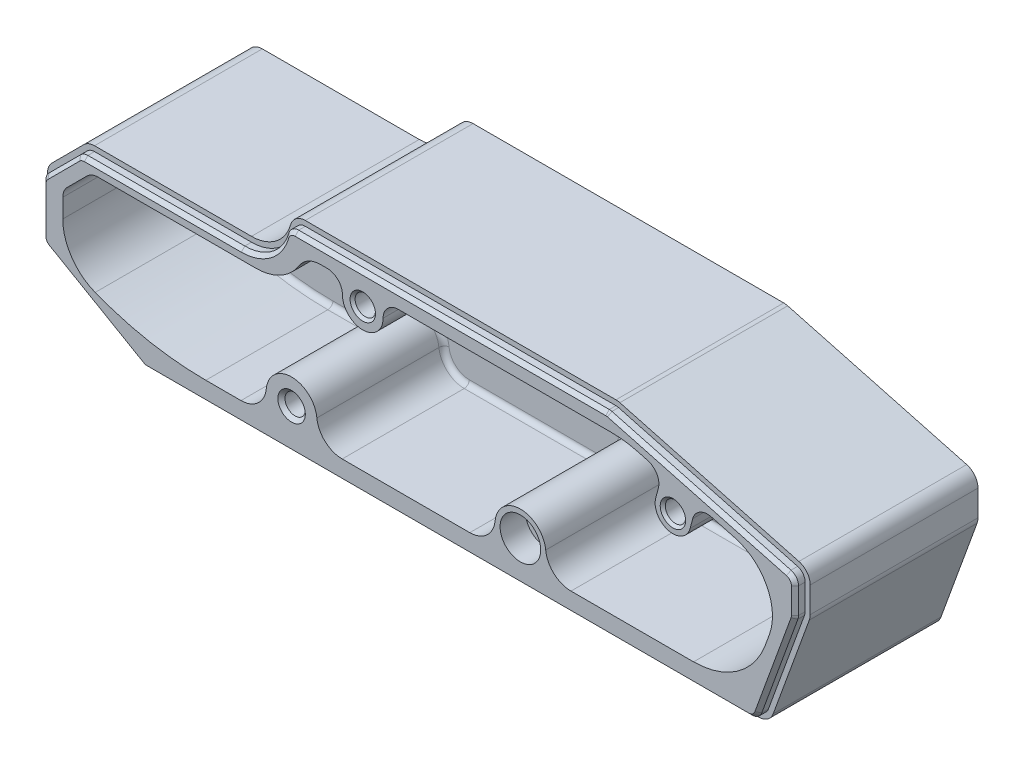
from build123d import *

# Parameters (mm, degrees)
EXTRUDE1_DEPTH     = 35
CUT_EXTRUDE1_DEPTH = 25
FILLET1_R          = 3
FILLET2_R          = 10
EXTRUDE2_DEPTH     = 25
FILLET3_R          = 5
FILLET4_R          = 3
CUT_SWEEP1_START   = 33
CUT_SWEEP1_DEPTH   = 2
CHAMFER1_SIZE      = 0.7
SKETCH6_R          = 2
CUT_EXTRUDE2_DEPTH = 15
CHAMFER2_SIZE      = 0.7
CHAMFER3_SIZE      = 0.5
FILLET5_R          = 1


# Read off the part's stored shape, not the designer's step: Cut-Sweep1
with BuildPart() as part:
    # Sketch1 → Extrude1 (new body)
    with BuildSketch(Plane.XY):
        with BuildLine():
            Line((-75, 4), (-67, 12))
            Line((-67, 12), (-34.892466166, 12))
            ThreePointArc((-34.892466166, 12), (-29.235611917, 14.343145751), (-26.892466166, 20))
            Line((-26.892466166, 20), (37.18825976, 20))
            Line((37.18825976, 20), (75, 9.868374738))
            Line((75, 9.868374738), (75, 1.979819356))
            Line((75, 1.979819356), (67, -20))
            Line((67, -20), (-54.215390309, -20))
            Line((-54.215390309, -20), (-75, -8))
            Line((-75, -8), (-75, 4))
        make_face()
    extrude(amount=EXTRUDE1_DEPTH)

    # Sketch2 → Cut-Extrude1 (cut)
    with BuildSketch(Plane.XY.offset(35)):
        with BuildLine():
            Line((-41.875277779, -15), (54.060027008, -15))
            ThreePointArc((54.060027008, -15), (62.663673554, -12.287280664), (68.15541632, -5.13030215))
            Line((68.15541632, -5.13030215), (68.975129378, -2.878159034))
            ThreePointArc((68.975129378, -2.878159034), (68.448311502, 5.159528532), (62.166393621, 10.201300662))
            Line((62.166393621, 10.201300662), (43.068684025, 15.318516526))
            ThreePointArc((43.068684025, 15.318516526), (40.502826968, 15.828897227), (37.892303123, 16))
            Line((37.892303123, 16), (-19.304008898, 16))
            ThreePointArc((-19.304008898, 16), (-21.804008898, 15.330127019), (-23.634135917, 13.5))
            ThreePointArc((-23.634135917, 13.5), (-25.524969168, 10.986121811), (-27.964262936, 9))
            Line((-27.964262936, 9), (-64.343145751, 9))
            Line((-64.343145751, 9), (-70, 3.343145751))
            Line((-70, 3.343145751), (-70, -8))
            ThreePointArc((-70, -8), (-56.366654525, -13.223706512), (-41.875277779, -15))
        make_face()
    extrude(amount=-CUT_EXTRUDE1_DEPTH, mode=Mode.SUBTRACT)

    # Fillet1
    fillet1_edges = [part.edges().sort_by_distance(p)[0] for p in [
        (-75, -8, 17.5),
        (-75, 4, 17.5),
        (-67, 12, 17.5),
        (-26.892466166, 20, 17.5),
        (37.18825976, 20, 17.5),
        (75, 9.868374738, 17.5),
        (75, 1.979819356, 17.5),
        (67, -20, 17.5),
        (-54.215390309, -20, 17.5),
    ]]
    fillet(fillet1_edges, radius=FILLET1_R)

    # Fillet2
    fillet2_edges = [part.edges().sort_by_distance(p)[0] for p in [
        (-27.964262936, 9, 22.5),
        (-70, -8, 22.5),
    ]]
    fillet(fillet2_edges, radius=FILLET2_R)

    # Sketch3 → Extrude2 (add)
    with BuildSketch(Plane.XY.offset(10)):
        with BuildLine():
            Line((-30, -11), (-30, -15))
            Line((-30, -15), (-20, -15))
            Line((-20, -15), (-20, -11))
            ThreePointArc((-20, -11), (-25, -6), (-30, -11))
        make_face()
        with BuildLine():
            Line((-15, 13), (-15, 16))
            Line((-15, 16), (-7, 16))
            Line((-7, 16), (-7, 13))
            ThreePointArc((-7, 13), (-11, 9), (-15, 13))
        make_face()
        with BuildLine():
            Line((15, -15), (15, -11))
            ThreePointArc((15, -11), (20, -6), (25, -11))
            Line((25, -11), (25, -15))
            Line((25, -15), (15, -15))
        make_face()
        with BuildLine():
            Line((46.619259608, 9.190761764), (47.913354834, 14.020390895))
            Line((47.913354834, 14.020390895), (54.674835618, 12.208657579))
            Line((54.674835618, 12.208657579), (53.380740392, 7.379028448))
            ThreePointArc((53.380740392, 7.379028448), (49.094133342, 4.904154714), (46.619259608, 9.190761764))
        make_face()
    extrude(amount=EXTRUDE2_DEPTH)

    # Fillet3
    fillet3_edges = [part.edges().sort_by_distance(p)[0] for p in [
        (-30, -15, 22.5),
        (-20, -15, 22.5),
        (15, -15, 22.5),
        (25, -15, 22.5),
    ]]
    fillet(fillet3_edges, radius=FILLET3_R)

    # Fillet4
    fillet4_edges = [part.edges().sort_by_distance(p)[0] for p in [
        (54.674835618, 12.208657579, 22.5),
        (47.913354834, 14.020390895, 22.5),
        (-70, 3.343145751, 22.5),
        (-64.343145751, 9, 22.5),
        (-15, 16, 22.5),
        (-7, 16, 22.5),
    ]]
    fillet(fillet4_edges, radius=FILLET4_R - 0.0001)  # a hair under: the kernel refuses the full size

    # Cut-Sweep1 outline → Cut-Sweep1 (cut)
    with BuildSketch(Plane.XY.offset(CUT_SWEEP1_START)):
        with BuildLine():
            ThreePointArc((64.899377385, -20), (66.620106694, -19.457456133), (67.718455248, -18.02606043))
            Line((67.718455248, -18.02606043), (74.819077862, 1.482739868))
            ThreePointArc((74.819077862, 1.482739868), (74.954423259, 1.987855765), (75, 2.508800298))
            Line((75, 2.508800298), (75, 7.566393774))
            ThreePointArc((75, 7.566393774), (74.380060021, 9.392678061), (72.776457135, 10.464171253))
            Line((72.776457135, 10.464171253), (37.569759403, 19.897777479))
            ThreePointArc((37.569759403, 19.897777479), (37.184880844, 19.974334584), (36.793302267, 20))
            Line((36.793302267, 20), (-24.309460922, 20))
            ThreePointArc((-24.309460922, 20), (-26.118528989, 19.393172106), (-27.195735079, 17.818181818))
            ThreePointArc((-27.195735079, 17.818181818), (-30.068284653, 13.618207718), (-34.892466166, 12))
            Line((-34.892466166, 12), (-65.757359313, 12))
            ThreePointArc((-65.757359313, 12), (-66.90540961, 11.771638598), (-67.878679656, 11.121320344))
            Line((-67.878679656, 11.121320344), (-74.121320344, 4.878679656))
            ThreePointArc((-74.121320344, 4.878679656), (-74.771638598, 3.90540961), (-75, 2.757359313))
            Line((-75, 2.757359313), (-75, -6.267949192))
            ThreePointArc((-75, -6.267949192), (-74.598076211, -7.767949192), (-73.5, -8.866025404))
            Line((-73.5, -8.866025404), (-54.911542732, -19.598076211))
            ThreePointArc((-54.911542732, -19.598076211), (-54.187999867, -19.897777479), (-53.411542732, -20))
            Line((-53.411542732, -20), (64.899377385, -20))
        make_face()
        with BuildLine():
            Line((73.879385242, 1.824760011), (66.778762627, -17.684040287))
            ThreePointArc((66.778762627, -17.684040287), (66.046530258, -18.638304089), (64.899377385, -19))
            Line((64.899377385, -19), (-53.411542732, -19))
            ThreePointArc((-53.411542732, -19), (-53.929180822, -18.931851653), (-54.411542732, -18.732050808))
            Line((-54.411542732, -18.732050808), (-73, -8))
            ThreePointArc((-73, -8), (-73.732050808, -7.267949192), (-74, -6.267949192))
            Line((-74, -6.267949192), (-74, 2.757359313))
            ThreePointArc((-74, 2.757359313), (-73.847759065, 3.522726178), (-73.414213562, 4.171572875))
            Line((-73.414213562, 4.171572875), (-67.171572875, 10.414213562))
            ThreePointArc((-67.171572875, 10.414213562), (-66.522726178, 10.847759065), (-65.757359313, 11))
            Line((-65.757359313, 11), (-34.892466166, 11))
            ThreePointArc((-34.892466166, 11), (-29.465261964, 12.820483683), (-26.233643694, 17.545454545))
            ThreePointArc((-26.233643694, 17.545454545), (-25.5155063, 18.59544807), (-24.309460922, 19))
            Line((-24.309460922, 19), (36.793302267, 19))
            ThreePointArc((36.793302267, 19), (37.054354652, 18.982889723), (37.310940358, 18.931851653))
            Line((37.310940358, 18.931851653), (72.51763809, 9.498245427))
            ThreePointArc((72.51763809, 9.498245427), (73.586706681, 8.783916632), (74, 7.566393774))
            Line((74, 7.566393774), (74, 2.508800298))
            ThreePointArc((74, 2.508800298), (73.969615506, 2.161503943), (73.879385242, 1.824760011))
        make_face(mode=Mode.SUBTRACT)
    extrude(amount=CUT_SWEEP1_DEPTH, mode=Mode.SUBTRACT)

    # Chamfer1
    chamfer1_edges = [part.edges().sort_by_distance(p)[0] for p in [
        (-53.929180822, -18.931851653, 35),
        (-63.705771366, -13.366025404, 35),
        (-73.732050808, -7.267949192, 35),
        (-74, -1.755294939, 35),
        (-73.847759065, 3.522726178, 35),
        (-70.292893218, 7.292893218, 35),
        (-66.522726178, 10.847759065, 35),
        (-50.324912739, 11, 35),
        (-29.465261964, 12.820483683, 35),
        (-25.5155063, 18.59544807, 35),
        (6.241920673, 19, 35),
        (37.054354652, 18.982889723, 35),
        (54.914289224, 14.21504854, 35),
        (73.586706681, 8.783916632, 35),
        (74, 5.037597036, 35),
        (73.969615506, 2.161503943, 35),
        (70.329073935, -7.929640138, 35),
        (66.046530258, -18.638304089, 35),
        (5.743917326, -19, 35),
    ]]
    chamfer(chamfer1_edges, length=CHAMFER1_SIZE)

    # Sketch5 → Cut-Revolve1 (revolve, cut)
    with BuildSketch(Plane(origin=(20, 0, 0), x_dir=(0, 0, -1), z_dir=(1, 0, 0)), mode=Mode.PRIVATE) as cut_revolve1_sk:
        Polygon((-35, -11), (-35, -7), (-30, -7), (-30, -8.75), (-16.299038106, -8.75), (-15, -11), align=None)
    revolve(cut_revolve1_sk.sketch.rotate(Axis((20, -11, 35), (0, 0, -1)), 90), axis=Axis((20, -11, 35), (0, 0, -1)), mode=Mode.SUBTRACT)

    # Sketch6 → Cut-Extrude2 (cut)
    with BuildSketch(Plane.XY.offset(35)):
        with Locations((-25, -11)):
            Circle(SKETCH6_R)
        with Locations((-11, 13)):
            Circle(SKETCH6_R)
        with Locations((50, 8.284895106)):
            Circle(SKETCH6_R)
    extrude(amount=-CUT_EXTRUDE2_DEPTH, mode=Mode.SUBTRACT)

    # Chamfer2
    chamfer2_edges = [part.edges().sort_by_distance(p)[0] for p in [
        (-27, -11, 35),
    ]]
    chamfer(chamfer2_edges, length=CHAMFER2_SIZE)

    # Chamfer3
    chamfer3_edges = [part.edges().sort_by_distance(p)[0] for p in [
        (-13, 13, 35),
        (48, 8.284895106, 35),
    ]]
    chamfer(chamfer3_edges, length=CHAMFER3_SIZE)

    # Fillet5
    fillet5_edges = [part.edges().sort_by_distance(p)[0] for p in [
        (-52.939875471, -13.970964702, 10),
        (-47.546566462, 9, 10),
        (-68.253770182, -7.245116104, 10),
        (-27.162127523, 10.244049642, 10),
        (-11, 9, 10),
        (53.639572378, 8.345002571, 10),
        (49.094133342, 4.904154714, 10),
        (-2.5, -15, 10),
        (-25, -6, 10),
        (20, -6, 10),
        (42.00495069, -15, 10),
        (-18.404227595, -13.708099244, 10),
        (-31.595772405, -13.708099244, 10),
        (26.595772405, -13.708099244, 10),
        (13.404227595, -13.708099244, 10),
        (-70, 0.250624938, 10),
        (-67.171572875, 6.171572875, 10),
        (46.878091594, 10.156735886, 10),
        (44.042178986, 15.057669337, 10),
        (-18.651954449, 16, 10),
        (46.837232303, 13.399091262, 10),
        (55.29613525, 11.132535049, 10),
        (-6.121349633, 15.121349633, 10),
        (-15.878650367, 15.121349633, 10),
        (-64.248558513, 8.77164621, 10),
        (-69.77164621, 3.248558513, 10),
        (59.869455062, 10.816763494, 10),
        (40.502826968, 15.828897227, 10),
        (16.946101562, 16, 10),
        (-21.719238356, 15.377975179, 10),
        (-38.412576075, -15, 10),
        (62.663673554, -12.287280664, 10),
        (68.565272849, -4.004230592, 10),
        (68.448311502, 5.159528532, 10),
    ]]
    fillet(fillet5_edges, radius=FILLET5_R)


solid = part.part
